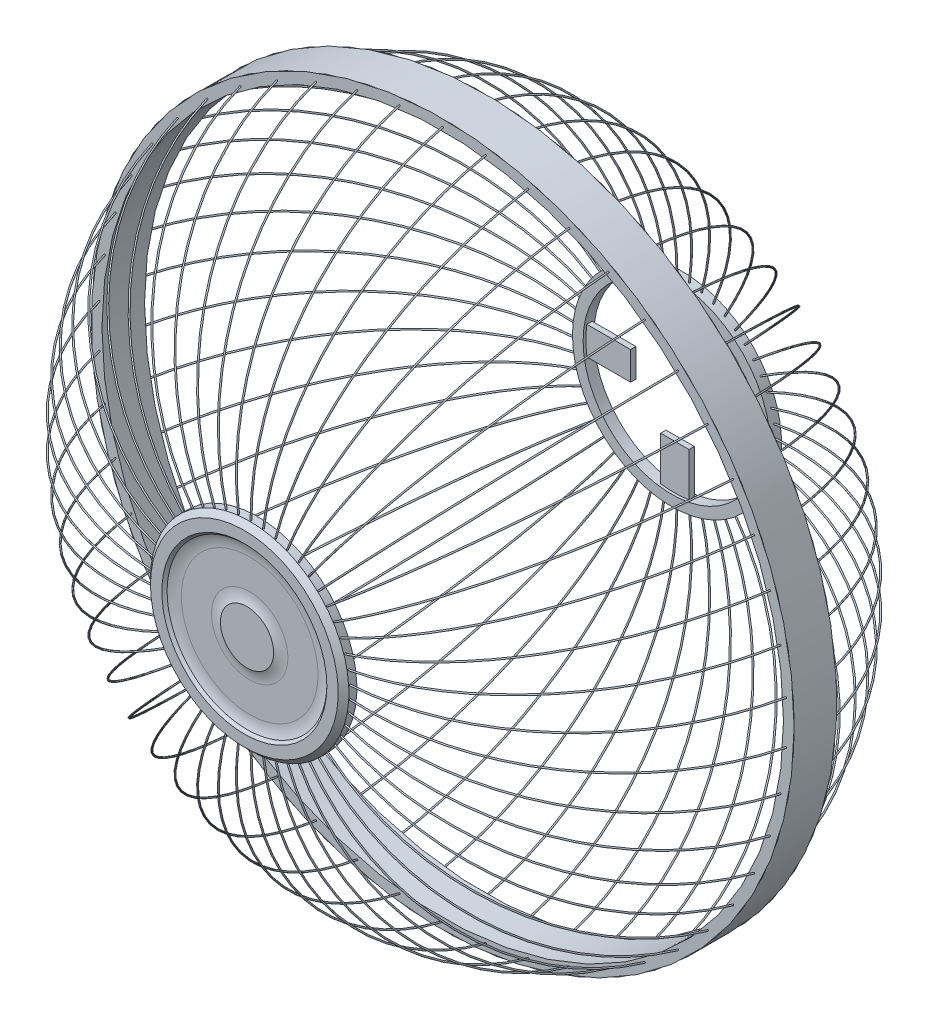
from build123d import *

# Parameters (mm, degrees)
SKETCH1_R                    = 167.64
SKETCH1_R_2                  = 162.56
EXTRUDE_THIN1_DEPTH          = 10.16
SKETCH2_R                    = 47.325577307
BOSS_EXTRUDE1_DEPTH          = 3.175
SKETCH10_R                   = 0.3175
SKETCH12_R                   = 47.325577307
SKETCH12_R_2                 = 42.245577307
EXTRUDE_THIN2_DEPTH          = 2.54
CHAMFER1_SIZE                = 2.54
SKETCH13_R                   = 38.1
CUT_EXTRUDE1_DEPTH           = 2.54
CHAMFER2_SIZE                = 1.27
SKETCH14_R                   = 12.7
BOSS_EXTRUDE3_DEPTH          = 1.27
FILLET1_R                    = 12.7
FILLET2_R                    = 12.7
CIRPATTERN1_COUNT            = 50
CIRPATTERN2_COUNT            = 2
CIRPATTERN2_COPY_1_SKETCH_R  = 0.3175
CIRPATTERN2_COPY_2_SKETCH_R  = 0.3175
CIRPATTERN2_COPY_3_SKETCH_R  = 0.3175
CIRPATTERN2_COPY_4_SKETCH_R  = 0.3175
CIRPATTERN2_COPY_5_SKETCH_R  = 0.3175
CIRPATTERN2_COPY_6_SKETCH_R  = 0.3175
CIRPATTERN2_COPY_7_SKETCH_R  = 0.3175
CIRPATTERN2_COPY_8_SKETCH_R  = 0.3175
CIRPATTERN2_COPY_9_SKETCH_R  = 0.3175
CIRPATTERN2_COPY_10_SKETCH_R = 0.3175
CIRPATTERN2_COPY_11_SKETCH_R = 0.3175
CIRPATTERN2_COPY_12_SKETCH_R = 0.3175
CIRPATTERN2_COPY_13_SKETCH_R = 0.3175
CIRPATTERN2_COPY_14_SKETCH_R = 0.3175
CIRPATTERN2_COPY_15_SKETCH_R = 0.3175
CIRPATTERN2_COPY_16_SKETCH_R = 0.3175
CIRPATTERN2_COPY_17_SKETCH_R = 0.3175
CIRPATTERN2_COPY_18_SKETCH_R = 0.3175
CIRPATTERN2_COPY_19_SKETCH_R = 0.3175
CIRPATTERN2_COPY_20_SKETCH_R = 0.3175
CIRPATTERN2_COPY_21_SKETCH_R = 0.3175
CIRPATTERN2_COPY_22_SKETCH_R = 0.3175
CIRPATTERN2_COPY_23_SKETCH_R = 0.3175
CIRPATTERN2_COPY_24_SKETCH_R = 0.3175
CIRPATTERN2_COPY_25_SKETCH_R = 0.3175
CIRPATTERN2_COPY_26_SKETCH_R = 0.3175
CIRPATTERN2_COPY_27_SKETCH_R = 0.3175
CIRPATTERN2_COPY_28_SKETCH_R = 0.3175
CIRPATTERN2_COPY_29_SKETCH_R = 0.3175
CIRPATTERN2_COPY_30_SKETCH_R = 0.3175
CIRPATTERN2_COPY_31_SKETCH_R = 0.3175
CIRPATTERN2_COPY_32_SKETCH_R = 0.3175
CIRPATTERN2_COPY_33_SKETCH_R = 0.3175
CIRPATTERN2_COPY_34_SKETCH_R = 0.3175
CIRPATTERN2_COPY_35_SKETCH_R = 0.3175
CIRPATTERN2_COPY_36_SKETCH_R = 0.3175
CIRPATTERN2_COPY_37_SKETCH_R = 0.3175
CIRPATTERN2_COPY_38_SKETCH_R = 0.3175
CIRPATTERN2_COPY_39_SKETCH_R = 0.3175
CIRPATTERN2_COPY_40_SKETCH_R = 0.3175
CIRPATTERN2_COPY_41_SKETCH_R = 0.3175
CIRPATTERN2_COPY_42_SKETCH_R = 0.3175
CIRPATTERN2_COPY_43_SKETCH_R = 0.3175
CIRPATTERN2_COPY_44_SKETCH_R = 0.3175
CIRPATTERN2_COPY_45_SKETCH_R = 0.3175
CIRPATTERN2_COPY_46_SKETCH_R = 0.3175
CIRPATTERN2_COPY_47_SKETCH_R = 0.3175
CIRPATTERN2_COPY_48_SKETCH_R = 0.3175
CIRPATTERN2_COPY_49_SKETCH_R = 0.3175
BOSS_EXTRUDE4_DEPTH          = 1.27
CIRPATTERN4_COUNT            = 4


with BuildPart() as part:
    # Sketch1 → Extrude-Thin1 (new, symmetric)
    with BuildSketch(Plane.XY):
        Circle(SKETCH1_R)
        Circle(SKETCH1_R_2, mode=Mode.SUBTRACT)
    extrude(amount=EXTRUDE_THIN1_DEPTH, both=True)

    # Sweep5: sweep along a path in Sketch4
    with BuildLine(Plane(origin=(0, 0, 0), x_dir=(0, 0, -1), z_dir=(1, 0, 0))) as sweep5_path:
        ThreePointArc((-10.16, 164.089600438), (-76.211159809, 121.629284641), (-101.6, 47.325577307))
    # Sketch10 → Sweep5 (sweep)
    with BuildSketch(Plane(origin=(0, 47.325577307, 101.6), x_dir=(1, 0, 0), z_dir=(0, 1, 0))):
        Circle(SKETCH10_R)
    sweep5 = sweep(path=sweep5_path.line)

    # CirPattern1: Sweep5 ×50 about axis
    cirpattern1_axis = Axis((0, 0, 10.16), (0, 0, 1))
    for i in range(1, CIRPATTERN1_COUNT):
        add(sweep5.rotate(cirpattern1_axis, i * 360 / CIRPATTERN1_COUNT))

    # CirPattern2: Sweep5 ×2 about axis
    cirpattern2_axis = Axis((0, 243.078, 0), (0, -1, 0))
    for i in range(1, CIRPATTERN2_COUNT):
        add(sweep5.rotate(cirpattern2_axis, i * 360 / CIRPATTERN2_COUNT))

    # CirPattern2 copy 1: sweep along a path in CirPattern2 copy 1 path
    with BuildLine(Plane(origin=(0, 0, 0), x_dir=(0, 0, 1), z_dir=(-0.9921147013144779, 0.12533323356430426, 0))) as cirpattern2_copy_1_path:
        ThreePointArc((-10.16, 164.089600438), (-76.211159809, 121.629284641), (-101.6, 47.325577307))
    # CirPattern2 copy 1 sketch → CirPattern2 copy 1 (sweep)
    with BuildSketch(Plane(origin=(5.931467634, 46.952400995, -101.6), x_dir=(-0.9921147013144779, 0.1253332335643043, 0), z_dir=(0.1253332335643043, 0.9921147013144779, 0))):
        Circle(CIRPATTERN2_COPY_1_SKETCH_R)
    sweep(path=cirpattern2_copy_1_path.line)

    # CirPattern2 copy 2: sweep along a path in CirPattern2 copy 2 path
    with BuildLine(Plane(origin=(0, 0, 0), x_dir=(0, 0, 1), z_dir=(-0.9685831611286311, 0.2486898871648548, 0))) as cirpattern2_copy_2_path:
        ThreePointArc((-10.16, 164.089600438), (-76.211159809, 121.629284641), (-101.6, 47.325577307))
    # CirPattern2 copy 2 sketch → CirPattern2 copy 2 (sweep)
    with BuildSketch(Plane(origin=(11.769392481, 45.83875727, -101.6), x_dir=(-0.9685831611286311, 0.24868988716485485, 0), z_dir=(0.24868988716485485, 0.9685831611286311, 0))):
        Circle(CIRPATTERN2_COPY_2_SKETCH_R)
    sweep(path=cirpattern2_copy_2_path.line)

    # CirPattern2 copy 3: sweep along a path in CirPattern2 copy 3 path
    with BuildLine(Plane(origin=(0, 0, 0), x_dir=(0, 0, 1), z_dir=(-0.9297764858882513, 0.368124552684678, 0))) as cirpattern2_copy_3_path:
        ThreePointArc((-10.16, 164.089600438), (-76.211159809, 121.629284641), (-101.6, 47.325577307))
    # CirPattern2 copy 3 sketch → CirPattern2 copy 3 (sweep)
    with BuildSketch(Plane(origin=(17.421706977, 44.002208961, -101.6), x_dir=(-0.9297764858882513, 0.36812455268467803, 0), z_dir=(0.36812455268467803, 0.9297764858882513, 0))):
        Circle(CIRPATTERN2_COPY_3_SKETCH_R)
    sweep(path=cirpattern2_copy_3_path.line)

    # CirPattern2 copy 4: sweep along a path in CirPattern2 copy 4 path
    with BuildLine(Plane(origin=(0, 0, 0), x_dir=(0, 0, 1), z_dir=(-0.8763066800438636, 0.4817536741017153, 0))) as cirpattern2_copy_4_path:
        ThreePointArc((-10.16, 164.089600438), (-76.211159809, 121.629284641), (-101.6, 47.325577307))
    # CirPattern2 copy 4 sketch → CirPattern2 copy 4 (sweep)
    with BuildSketch(Plane(origin=(22.799270747, 41.471719531, -101.6), x_dir=(-0.8763066800438636, 0.4817536741017154, 0), z_dir=(0.4817536741017154, 0.8763066800438636, 0))):
        Circle(CIRPATTERN2_COPY_4_SKETCH_R)
    sweep(path=cirpattern2_copy_4_path.line)

    # CirPattern2 copy 5: sweep along a path in CirPattern2 copy 5 path
    with BuildLine(Plane(origin=(0, 0, 0), x_dir=(0, 0, 1), z_dir=(-0.8090169943749475, 0.5877852522924731, 0))) as cirpattern2_copy_5_path:
        ThreePointArc((-10.16, 164.089600438), (-76.211159809, 121.629284641), (-101.6, 47.325577307))
    # CirPattern2 copy 5 sketch → CirPattern2 copy 5 (sweep)
    with BuildSketch(Plane(origin=(27.817276397, 38.28719631, -101.6), x_dir=(-0.8090169943749475, 0.5877852522924731, 0), z_dir=(0.5877852522924731, 0.8090169943749475, 0))):
        Circle(CIRPATTERN2_COPY_5_SKETCH_R)
    sweep(path=cirpattern2_copy_5_path.line)

    # CirPattern2 copy 6: sweep along a path in CirPattern2 copy 6 path
    with BuildLine(Plane(origin=(0, 0, 0), x_dir=(0, 0, 1), z_dir=(-0.7289686274214116, 0.6845471059286887, 0))) as cirpattern2_copy_6_path:
        ThreePointArc((-10.16, 164.089600438), (-76.211159809, 121.629284641), (-101.6, 47.325577307))
    # CirPattern2 copy 6 sketch → CirPattern2 copy 6 (sweep)
    with BuildSketch(Plane(origin=(32.396586982, 34.498861131, -101.6), x_dir=(-0.7289686274214116, 0.6845471059286887, 0), z_dir=(0.6845471059286887, 0.7289686274214116, 0))):
        Circle(CIRPATTERN2_COPY_6_SKETCH_R)
    sweep(path=cirpattern2_copy_6_path.line)

    # CirPattern2 copy 7: sweep along a path in CirPattern2 copy 7 path
    with BuildLine(Plane(origin=(0, 0, 0), x_dir=(0, 0, 1), z_dir=(-0.6374239897486897, 0.7705132427757893, 0))) as cirpattern2_copy_7_path:
        ThreePointArc((-10.16, 164.089600438), (-76.211159809, 121.629284641), (-101.6, 47.325577307))
    # CirPattern2 copy 7 sketch → CirPattern2 copy 7 (sweep)
    with BuildSketch(Plane(origin=(36.464984037, 30.166458304, -101.6), x_dir=(-0.6374239897486897, 0.7705132427757893, 0), z_dir=(0.7705132427757893, 0.6374239897486897, 0))):
        Circle(CIRPATTERN2_COPY_7_SKETCH_R)
    sweep(path=cirpattern2_copy_7_path.line)

    # CirPattern2 copy 8: sweep along a path in CirPattern2 copy 8 path
    with BuildLine(Plane(origin=(0, 0, 0), x_dir=(0, 0, 1), z_dir=(-0.5358267949789965, 0.8443279255020151, 0))) as cirpattern2_copy_8_path:
        ThreePointArc((-10.16, 164.089600438), (-76.211159809, 121.629284641), (-101.6, 47.325577307))
    # CirPattern2 copy 8 sketch → CirPattern2 copy 8 (sweep)
    with BuildSketch(Plane(origin=(39.958306511, 25.358312409, -101.6), x_dir=(-0.5358267949789965, 0.8443279255020151, 0), z_dir=(0.8443279255020151, 0.5358267949789965, 0))):
        Circle(CIRPATTERN2_COPY_8_SKETCH_R)
    sweep(path=cirpattern2_copy_8_path.line)

    # CirPattern2 copy 9: sweep along a path in CirPattern2 copy 9 path
    with BuildLine(Plane(origin=(0, 0, 0), x_dir=(0, 0, 1), z_dir=(-0.42577929156507266, 0.9048270524660196, 0))) as cirpattern2_copy_9_path:
        ThreePointArc((-10.16, 164.089600438), (-76.211159809, 121.629284641), (-101.6, 47.325577307))
    # CirPattern2 copy 9 sketch → CirPattern2 copy 9 (sweep)
    with BuildSketch(Plane(origin=(42.821462621, 20.150250779, -101.6), x_dir=(-0.4257792915650726, 0.9048270524660196, 0), z_dir=(0.9048270524660196, 0.4257792915650726, 0))):
        Circle(CIRPATTERN2_COPY_9_SKETCH_R)
    sweep(path=cirpattern2_copy_9_path.line)

    # CirPattern2 copy 10: sweep along a path in CirPattern2 copy 10 path
    with BuildLine(Plane(origin=(0, 0, 0), x_dir=(0, 0, 1), z_dir=(-0.30901699437494745, 0.9510565162951535, 0))) as cirpattern2_copy_10_path:
        ThreePointArc((-10.16, 164.089600438), (-76.211159809, 121.629284641), (-101.6, 47.325577307))
    # CirPattern2 copy 10 sketch → CirPattern2 copy 10 (sweep)
    with BuildSketch(Plane(origin=(45.009298685, 14.624407656, -101.6), x_dir=(-0.3090169943749474, 0.9510565162951535, 0), z_dir=(0.9510565162951535, 0.3090169943749474, 0))):
        Circle(CIRPATTERN2_COPY_10_SKETCH_R)
    sweep(path=cirpattern2_copy_10_path.line)

    # CirPattern2 copy 11: sweep along a path in CirPattern2 copy 11 path
    with BuildLine(Plane(origin=(0, 0, 0), x_dir=(0, 0, 1), z_dir=(-0.18738131458572452, 0.9822872507286887, 0))) as cirpattern2_copy_11_path:
        ThreePointArc((-10.16, 164.089600438), (-76.211159809, 121.629284641), (-101.6, 47.325577307))
    # CirPattern2 copy 11 sketch → CirPattern2 copy 11 (sweep)
    with BuildSketch(Plane(origin=(46.487311222, 8.867928889, -101.6), x_dir=(-0.18738131458572446, 0.9822872507286887, 0), z_dir=(0.9822872507286887, 0.18738131458572446, 0))):
        Circle(CIRPATTERN2_COPY_11_SKETCH_R)
    sweep(path=cirpattern2_copy_11_path.line)

    # CirPattern2 copy 12: sweep along a path in CirPattern2 copy 12 path
    with BuildLine(Plane(origin=(0, 0, 0), x_dir=(0, 0, 1), z_dir=(-0.0627905195293133, 0.9980267284282716, 0))) as cirpattern2_copy_12_path:
        ThreePointArc((-10.16, 164.089600438), (-76.211159809, 121.629284641), (-101.6, 47.325577307))
    # CirPattern2 copy 12 sketch → CirPattern2 copy 12 (sweep)
    with BuildSketch(Plane(origin=(47.232191091, 2.971597586, -101.6), x_dir=(-0.06279051952931325, 0.9980267284282716, 0), z_dir=(0.9980267284282716, 0.06279051952931325, 0))):
        Circle(CIRPATTERN2_COPY_12_SKETCH_R)
    sweep(path=cirpattern2_copy_12_path.line)

    # CirPattern2 copy 13: sweep along a path in CirPattern2 copy 13 path
    with BuildLine(Plane(origin=(0, 0, 0), x_dir=(0, 0, 1), z_dir=(0.0627905195293134, 0.9980267284282716, 0))) as cirpattern2_copy_13_path:
        ThreePointArc((-10.16, 164.089600438), (-76.211159809, 121.629284641), (-101.6, 47.325577307))
    # CirPattern2 copy 13 sketch → CirPattern2 copy 13 (sweep)
    with BuildSketch(Plane(origin=(47.232191091, -2.971597586, -101.6), x_dir=(0.06279051952931346, 0.9980267284282716, 0), z_dir=(0.9980267284282716, -0.06279051952931346, 0))):
        Circle(CIRPATTERN2_COPY_13_SKETCH_R)
    sweep(path=cirpattern2_copy_13_path.line)

    # CirPattern2 copy 14: sweep along a path in CirPattern2 copy 14 path
    with BuildLine(Plane(origin=(0, 0, 0), x_dir=(0, 0, 1), z_dir=(0.1873813145857246, 0.9822872507286887, 0))) as cirpattern2_copy_14_path:
        ThreePointArc((-10.16, 164.089600438), (-76.211159809, 121.629284641), (-101.6, 47.325577307))
    # CirPattern2 copy 14 sketch → CirPattern2 copy 14 (sweep)
    with BuildSketch(Plane(origin=(46.487311222, -8.867928889, -101.6), x_dir=(0.18738131458572466, 0.9822872507286887, 0), z_dir=(0.9822872507286887, -0.18738131458572466, 0))):
        Circle(CIRPATTERN2_COPY_14_SKETCH_R)
    sweep(path=cirpattern2_copy_14_path.line)

    # CirPattern2 copy 15: sweep along a path in CirPattern2 copy 15 path
    with BuildLine(Plane(origin=(0, 0, 0), x_dir=(0, 0, 1), z_dir=(0.30901699437494734, 0.9510565162951536, 0))) as cirpattern2_copy_15_path:
        ThreePointArc((-10.16, 164.089600438), (-76.211159809, 121.629284641), (-101.6, 47.325577307))
    # CirPattern2 copy 15 sketch → CirPattern2 copy 15 (sweep)
    with BuildSketch(Plane(origin=(45.009298685, -14.624407656, -101.6), x_dir=(0.3090169943749474, 0.9510565162951536, 0), z_dir=(0.9510565162951536, -0.3090169943749474, 0))):
        Circle(CIRPATTERN2_COPY_15_SKETCH_R)
    sweep(path=cirpattern2_copy_15_path.line)

    # CirPattern2 copy 16: sweep along a path in CirPattern2 copy 16 path
    with BuildLine(Plane(origin=(0, 0, 0), x_dir=(0, 0, 1), z_dir=(0.4257792915650727, 0.9048270524660195, 0))) as cirpattern2_copy_16_path:
        ThreePointArc((-10.16, 164.089600438), (-76.211159809, 121.629284641), (-101.6, 47.325577307))
    # CirPattern2 copy 16 sketch → CirPattern2 copy 16 (sweep)
    with BuildSketch(Plane(origin=(42.821462621, -20.150250779, -101.6), x_dir=(0.42577929156507277, 0.9048270524660195, 0), z_dir=(0.9048270524660195, -0.42577929156507277, 0))):
        Circle(CIRPATTERN2_COPY_16_SKETCH_R)
    sweep(path=cirpattern2_copy_16_path.line)

    # CirPattern2 copy 17: sweep along a path in CirPattern2 copy 17 path
    with BuildLine(Plane(origin=(0, 0, 0), x_dir=(0, 0, 1), z_dir=(0.5358267949789969, 0.844327925502015, 0))) as cirpattern2_copy_17_path:
        ThreePointArc((-10.16, 164.089600438), (-76.211159809, 121.629284641), (-101.6, 47.325577307))
    # CirPattern2 copy 17 sketch → CirPattern2 copy 17 (sweep)
    with BuildSketch(Plane(origin=(39.958306511, -25.358312409, -101.6), x_dir=(0.5358267949789969, 0.844327925502015, 0), z_dir=(0.844327925502015, -0.5358267949789969, 0))):
        Circle(CIRPATTERN2_COPY_17_SKETCH_R)
    sweep(path=cirpattern2_copy_17_path.line)

    # CirPattern2 copy 18: sweep along a path in CirPattern2 copy 18 path
    with BuildLine(Plane(origin=(0, 0, 0), x_dir=(0, 0, 1), z_dir=(0.6374239897486897, 0.7705132427757893, 0))) as cirpattern2_copy_18_path:
        ThreePointArc((-10.16, 164.089600438), (-76.211159809, 121.629284641), (-101.6, 47.325577307))
    # CirPattern2 copy 18 sketch → CirPattern2 copy 18 (sweep)
    with BuildSketch(Plane(origin=(36.464984037, -30.166458304, -101.6), x_dir=(0.6374239897486897, 0.7705132427757893, 0), z_dir=(0.7705132427757893, -0.6374239897486897, 0))):
        Circle(CIRPATTERN2_COPY_18_SKETCH_R)
    sweep(path=cirpattern2_copy_18_path.line)

    # CirPattern2 copy 19: sweep along a path in CirPattern2 copy 19 path
    with BuildLine(Plane(origin=(0, 0, 0), x_dir=(0, 0, 1), z_dir=(0.7289686274214117, 0.6845471059286885, 0))) as cirpattern2_copy_19_path:
        ThreePointArc((-10.16, 164.089600438), (-76.211159809, 121.629284641), (-101.6, 47.325577307))
    # CirPattern2 copy 19 sketch → CirPattern2 copy 19 (sweep)
    with BuildSketch(Plane(origin=(32.396586982, -34.498861131, -101.6), x_dir=(0.7289686274214117, 0.6845471059286885, 0), z_dir=(0.6845471059286885, -0.7289686274214117, 0))):
        Circle(CIRPATTERN2_COPY_19_SKETCH_R)
    sweep(path=cirpattern2_copy_19_path.line)

    # CirPattern2 copy 20: sweep along a path in CirPattern2 copy 20 path
    with BuildLine(Plane(origin=(0, 0, 0), x_dir=(0, 0, 1), z_dir=(0.8090169943749473, 0.5877852522924732, 0))) as cirpattern2_copy_20_path:
        ThreePointArc((-10.16, 164.089600438), (-76.211159809, 121.629284641), (-101.6, 47.325577307))
    # CirPattern2 copy 20 sketch → CirPattern2 copy 20 (sweep)
    with BuildSketch(Plane(origin=(27.817276397, -38.28719631, -101.6), x_dir=(0.8090169943749473, 0.5877852522924732, 0), z_dir=(0.5877852522924732, -0.8090169943749473, 0))):
        Circle(CIRPATTERN2_COPY_20_SKETCH_R)
    sweep(path=cirpattern2_copy_20_path.line)

    # CirPattern2 copy 21: sweep along a path in CirPattern2 copy 21 path
    with BuildLine(Plane(origin=(0, 0, 0), x_dir=(0, 0, 1), z_dir=(0.8763066800438636, 0.4817536741017152, 0))) as cirpattern2_copy_21_path:
        ThreePointArc((-10.16, 164.089600438), (-76.211159809, 121.629284641), (-101.6, 47.325577307))
    # CirPattern2 copy 21 sketch → CirPattern2 copy 21 (sweep)
    with BuildSketch(Plane(origin=(22.799270747, -41.471719531, -101.6), x_dir=(0.8763066800438636, 0.48175367410171516, 0), z_dir=(0.48175367410171516, -0.8763066800438636, 0))):
        Circle(CIRPATTERN2_COPY_21_SKETCH_R)
    sweep(path=cirpattern2_copy_21_path.line)

    # CirPattern2 copy 22: sweep along a path in CirPattern2 copy 22 path
    with BuildLine(Plane(origin=(0, 0, 0), x_dir=(0, 0, 1), z_dir=(0.9297764858882515, 0.36812455268467775, 0))) as cirpattern2_copy_22_path:
        ThreePointArc((-10.16, 164.089600438), (-76.211159809, 121.629284641), (-101.6, 47.325577307))
    # CirPattern2 copy 22 sketch → CirPattern2 copy 22 (sweep)
    with BuildSketch(Plane(origin=(17.421706977, -44.002208961, -101.6), x_dir=(0.9297764858882515, 0.3681245526846777, 0), z_dir=(0.3681245526846777, -0.9297764858882515, 0))):
        Circle(CIRPATTERN2_COPY_22_SKETCH_R)
    sweep(path=cirpattern2_copy_22_path.line)

    # CirPattern2 copy 23: sweep along a path in CirPattern2 copy 23 path
    with BuildLine(Plane(origin=(0, 0, 0), x_dir=(0, 0, 1), z_dir=(0.9685831611286311, 0.24868988716485482, 0))) as cirpattern2_copy_23_path:
        ThreePointArc((-10.16, 164.089600438), (-76.211159809, 121.629284641), (-101.6, 47.325577307))
    # CirPattern2 copy 23 sketch → CirPattern2 copy 23 (sweep)
    with BuildSketch(Plane(origin=(11.769392481, -45.83875727, -101.6), x_dir=(0.9685831611286311, 0.24868988716485477, 0), z_dir=(0.24868988716485477, -0.9685831611286311, 0))):
        Circle(CIRPATTERN2_COPY_23_SKETCH_R)
    sweep(path=cirpattern2_copy_23_path.line)

    # CirPattern2 copy 24: sweep along a path in CirPattern2 copy 24 path
    with BuildLine(Plane(origin=(0, 0, 0), x_dir=(0, 0, 1), z_dir=(0.9921147013144779, 0.1253332335643041, 0))) as cirpattern2_copy_24_path:
        ThreePointArc((-10.16, 164.089600438), (-76.211159809, 121.629284641), (-101.6, 47.325577307))
    # CirPattern2 copy 24 sketch → CirPattern2 copy 24 (sweep)
    with BuildSketch(Plane(origin=(5.931467634, -46.952400995, -101.6), x_dir=(0.9921147013144779, 0.12533323356430404, 0), z_dir=(0.12533323356430404, -0.9921147013144779, 0))):
        Circle(CIRPATTERN2_COPY_24_SKETCH_R)
    sweep(path=cirpattern2_copy_24_path.line)

    # CirPattern2 copy 25: sweep along a path in CirPattern2 copy 25 path
    with BuildLine(Plane(origin=(0, 0, 0), x_dir=(0, 0, 1), z_dir=(1, 0, 0))) as cirpattern2_copy_25_path:
        ThreePointArc((-10.16, 164.089600438), (-76.211159809, 121.629284641), (-101.6, 47.325577307))
    # CirPattern2 copy 25 sketch → CirPattern2 copy 25 (sweep)
    with BuildSketch(Plane(origin=(0, -47.325577307, -101.6), x_dir=(1, 0, 0), z_dir=(0, -1, 0))):
        Circle(CIRPATTERN2_COPY_25_SKETCH_R)
    sweep(path=cirpattern2_copy_25_path.line)

    # CirPattern2 copy 26: sweep along a path in CirPattern2 copy 26 path
    with BuildLine(Plane(origin=(0, 0, 0), x_dir=(0, 0, 1), z_dir=(0.9921147013144779, -0.12533323356430429, 0))) as cirpattern2_copy_26_path:
        ThreePointArc((-10.16, 164.089600438), (-76.211159809, 121.629284641), (-101.6, 47.325577307))
    # CirPattern2 copy 26 sketch → CirPattern2 copy 26 (sweep)
    with BuildSketch(Plane(origin=(-5.931467634, -46.952400995, -101.6), x_dir=(0.9921147013144779, -0.12533323356430434, 0), z_dir=(-0.12533323356430434, -0.9921147013144779, 0))):
        Circle(CIRPATTERN2_COPY_26_SKETCH_R)
    sweep(path=cirpattern2_copy_26_path.line)

    # CirPattern2 copy 27: sweep along a path in CirPattern2 copy 27 path
    with BuildLine(Plane(origin=(0, 0, 0), x_dir=(0, 0, 1), z_dir=(0.9685831611286311, -0.24868988716485502, 0))) as cirpattern2_copy_27_path:
        ThreePointArc((-10.16, 164.089600438), (-76.211159809, 121.629284641), (-101.6, 47.325577307))
    # CirPattern2 copy 27 sketch → CirPattern2 copy 27 (sweep)
    with BuildSketch(Plane(origin=(-11.769392481, -45.83875727, -101.6), x_dir=(0.9685831611286311, -0.24868988716485507, 0), z_dir=(-0.24868988716485507, -0.9685831611286311, 0))):
        Circle(CIRPATTERN2_COPY_27_SKETCH_R)
    sweep(path=cirpattern2_copy_27_path.line)

    # CirPattern2 copy 28: sweep along a path in CirPattern2 copy 28 path
    with BuildLine(Plane(origin=(0, 0, 0), x_dir=(0, 0, 1), z_dir=(0.9297764858882515, -0.3681245526846779, 0))) as cirpattern2_copy_28_path:
        ThreePointArc((-10.16, 164.089600438), (-76.211159809, 121.629284641), (-101.6, 47.325577307))
    # CirPattern2 copy 28 sketch → CirPattern2 copy 28 (sweep)
    with BuildSketch(Plane(origin=(-17.421706977, -44.002208961, -101.6), x_dir=(0.9297764858882515, -0.368124552684678, 0), z_dir=(-0.368124552684678, -0.9297764858882515, 0))):
        Circle(CIRPATTERN2_COPY_28_SKETCH_R)
    sweep(path=cirpattern2_copy_28_path.line)

    # CirPattern2 copy 29: sweep along a path in CirPattern2 copy 29 path
    with BuildLine(Plane(origin=(0, 0, 0), x_dir=(0, 0, 1), z_dir=(0.8763066800438635, -0.4817536741017154, 0))) as cirpattern2_copy_29_path:
        ThreePointArc((-10.16, 164.089600438), (-76.211159809, 121.629284641), (-101.6, 47.325577307))
    # CirPattern2 copy 29 sketch → CirPattern2 copy 29 (sweep)
    with BuildSketch(Plane(origin=(-22.799270747, -41.471719531, -101.6), x_dir=(0.8763066800438635, -0.48175367410171543, 0), z_dir=(-0.48175367410171543, -0.8763066800438635, 0))):
        Circle(CIRPATTERN2_COPY_29_SKETCH_R)
    sweep(path=cirpattern2_copy_29_path.line)

    # CirPattern2 copy 30: sweep along a path in CirPattern2 copy 30 path
    with BuildLine(Plane(origin=(0, 0, 0), x_dir=(0, 0, 1), z_dir=(0.8090169943749476, -0.587785252292473, 0))) as cirpattern2_copy_30_path:
        ThreePointArc((-10.16, 164.089600438), (-76.211159809, 121.629284641), (-101.6, 47.325577307))
    # CirPattern2 copy 30 sketch → CirPattern2 copy 30 (sweep)
    with BuildSketch(Plane(origin=(-27.817276397, -38.28719631, -101.6), x_dir=(0.8090169943749476, -0.587785252292473, 0), z_dir=(-0.587785252292473, -0.8090169943749476, 0))):
        Circle(CIRPATTERN2_COPY_30_SKETCH_R)
    sweep(path=cirpattern2_copy_30_path.line)

    # CirPattern2 copy 31: sweep along a path in CirPattern2 copy 31 path
    with BuildLine(Plane(origin=(0, 0, 0), x_dir=(0, 0, 1), z_dir=(0.7289686274214116, -0.6845471059286887, 0))) as cirpattern2_copy_31_path:
        ThreePointArc((-10.16, 164.089600438), (-76.211159809, 121.629284641), (-101.6, 47.325577307))
    # CirPattern2 copy 31 sketch → CirPattern2 copy 31 (sweep)
    with BuildSketch(Plane(origin=(-32.396586982, -34.498861131, -101.6), x_dir=(0.7289686274214116, -0.6845471059286887, 0), z_dir=(-0.6845471059286887, -0.7289686274214116, 0))):
        Circle(CIRPATTERN2_COPY_31_SKETCH_R)
    sweep(path=cirpattern2_copy_31_path.line)

    # CirPattern2 copy 32: sweep along a path in CirPattern2 copy 32 path
    with BuildLine(Plane(origin=(0, 0, 0), x_dir=(0, 0, 1), z_dir=(0.6374239897486895, -0.7705132427757894, 0))) as cirpattern2_copy_32_path:
        ThreePointArc((-10.16, 164.089600438), (-76.211159809, 121.629284641), (-101.6, 47.325577307))
    # CirPattern2 copy 32 sketch → CirPattern2 copy 32 (sweep)
    with BuildSketch(Plane(origin=(-36.464984037, -30.166458304, -101.6), x_dir=(0.6374239897486895, -0.7705132427757894, 0), z_dir=(-0.7705132427757894, -0.6374239897486895, 0))):
        Circle(CIRPATTERN2_COPY_32_SKETCH_R)
    sweep(path=cirpattern2_copy_32_path.line)

    # CirPattern2 copy 33: sweep along a path in CirPattern2 copy 33 path
    with BuildLine(Plane(origin=(0, 0, 0), x_dir=(0, 0, 1), z_dir=(0.5358267949789971, -0.8443279255020149, 0))) as cirpattern2_copy_33_path:
        ThreePointArc((-10.16, 164.089600438), (-76.211159809, 121.629284641), (-101.6, 47.325577307))
    # CirPattern2 copy 33 sketch → CirPattern2 copy 33 (sweep)
    with BuildSketch(Plane(origin=(-39.958306511, -25.358312409, -101.6), x_dir=(0.5358267949789971, -0.8443279255020149, 0), z_dir=(-0.8443279255020149, -0.5358267949789971, 0))):
        Circle(CIRPATTERN2_COPY_33_SKETCH_R)
    sweep(path=cirpattern2_copy_33_path.line)

    # CirPattern2 copy 34: sweep along a path in CirPattern2 copy 34 path
    with BuildLine(Plane(origin=(0, 0, 0), x_dir=(0, 0, 1), z_dir=(0.42577929156507216, -0.9048270524660198, 0))) as cirpattern2_copy_34_path:
        ThreePointArc((-10.16, 164.089600438), (-76.211159809, 121.629284641), (-101.6, 47.325577307))
    # CirPattern2 copy 34 sketch → CirPattern2 copy 34 (sweep)
    with BuildSketch(Plane(origin=(-42.821462621, -20.150250779, -101.6), x_dir=(0.4257792915650721, -0.9048270524660198, 0), z_dir=(-0.9048270524660198, -0.4257792915650721, 0))):
        Circle(CIRPATTERN2_COPY_34_SKETCH_R)
    sweep(path=cirpattern2_copy_34_path.line)

    # CirPattern2 copy 35: sweep along a path in CirPattern2 copy 35 path
    with BuildLine(Plane(origin=(0, 0, 0), x_dir=(0, 0, 1), z_dir=(0.30901699437494756, -0.9510565162951535, 0))) as cirpattern2_copy_35_path:
        ThreePointArc((-10.16, 164.089600438), (-76.211159809, 121.629284641), (-101.6, 47.325577307))
    # CirPattern2 copy 35 sketch → CirPattern2 copy 35 (sweep)
    with BuildSketch(Plane(origin=(-45.009298685, -14.624407656, -101.6), x_dir=(0.3090169943749475, -0.9510565162951535, 0), z_dir=(-0.9510565162951535, -0.3090169943749475, 0))):
        Circle(CIRPATTERN2_COPY_35_SKETCH_R)
    sweep(path=cirpattern2_copy_35_path.line)

    # CirPattern2 copy 36: sweep along a path in CirPattern2 copy 36 path
    with BuildLine(Plane(origin=(0, 0, 0), x_dir=(0, 0, 1), z_dir=(0.18738131458572463, -0.9822872507286887, 0))) as cirpattern2_copy_36_path:
        ThreePointArc((-10.16, 164.089600438), (-76.211159809, 121.629284641), (-101.6, 47.325577307))
    # CirPattern2 copy 36 sketch → CirPattern2 copy 36 (sweep)
    with BuildSketch(Plane(origin=(-46.487311222, -8.867928889, -101.6), x_dir=(0.18738131458572457, -0.9822872507286887, 0), z_dir=(-0.9822872507286887, -0.18738131458572457, 0))):
        Circle(CIRPATTERN2_COPY_36_SKETCH_R)
    sweep(path=cirpattern2_copy_36_path.line)

    # CirPattern2 copy 37: sweep along a path in CirPattern2 copy 37 path
    with BuildLine(Plane(origin=(0, 0, 0), x_dir=(0, 0, 1), z_dir=(0.06279051952931321, -0.9980267284282716, 0))) as cirpattern2_copy_37_path:
        ThreePointArc((-10.16, 164.089600438), (-76.211159809, 121.629284641), (-101.6, 47.325577307))
    # CirPattern2 copy 37 sketch → CirPattern2 copy 37 (sweep)
    with BuildSketch(Plane(origin=(-47.232191091, -2.971597586, -101.6), x_dir=(0.06279051952931315, -0.9980267284282716, 0), z_dir=(-0.9980267284282716, -0.06279051952931315, 0))):
        Circle(CIRPATTERN2_COPY_37_SKETCH_R)
    sweep(path=cirpattern2_copy_37_path.line)

    # CirPattern2 copy 38: sweep along a path in CirPattern2 copy 38 path
    with BuildLine(Plane(origin=(0, 0, 0), x_dir=(0, 0, 1), z_dir=(-0.06279051952931372, -0.9980267284282716, 0))) as cirpattern2_copy_38_path:
        ThreePointArc((-10.16, 164.089600438), (-76.211159809, 121.629284641), (-101.6, 47.325577307))
    # CirPattern2 copy 38 sketch → CirPattern2 copy 38 (sweep)
    with BuildSketch(Plane(origin=(-47.232191091, 2.971597586, -101.6), x_dir=(-0.06279051952931378, -0.9980267284282716, 0), z_dir=(-0.9980267284282716, 0.06279051952931378, 0))):
        Circle(CIRPATTERN2_COPY_38_SKETCH_R)
    sweep(path=cirpattern2_copy_38_path.line)

    # CirPattern2 copy 39: sweep along a path in CirPattern2 copy 39 path
    with BuildLine(Plane(origin=(0, 0, 0), x_dir=(0, 0, 1), z_dir=(-0.18738131458572513, -0.9822872507286886, 0))) as cirpattern2_copy_39_path:
        ThreePointArc((-10.16, 164.089600438), (-76.211159809, 121.629284641), (-101.6, 47.325577307))
    # CirPattern2 copy 39 sketch → CirPattern2 copy 39 (sweep)
    with BuildSketch(Plane(origin=(-46.487311222, 8.867928889, -101.6), x_dir=(-0.18738131458572518, -0.9822872507286886, 0), z_dir=(-0.9822872507286886, 0.18738131458572518, 0))):
        Circle(CIRPATTERN2_COPY_39_SKETCH_R)
    sweep(path=cirpattern2_copy_39_path.line)

    # CirPattern2 copy 40: sweep along a path in CirPattern2 copy 40 path
    with BuildLine(Plane(origin=(0, 0, 0), x_dir=(0, 0, 1), z_dir=(-0.30901699437494723, -0.9510565162951536, 0))) as cirpattern2_copy_40_path:
        ThreePointArc((-10.16, 164.089600438), (-76.211159809, 121.629284641), (-101.6, 47.325577307))
    # CirPattern2 copy 40 sketch → CirPattern2 copy 40 (sweep)
    with BuildSketch(Plane(origin=(-45.009298685, 14.624407656, -101.6), x_dir=(-0.3090169943749473, -0.9510565162951536, 0), z_dir=(-0.9510565162951536, 0.3090169943749473, 0))):
        Circle(CIRPATTERN2_COPY_40_SKETCH_R)
    sweep(path=cirpattern2_copy_40_path.line)

    # CirPattern2 copy 41: sweep along a path in CirPattern2 copy 41 path
    with BuildLine(Plane(origin=(0, 0, 0), x_dir=(0, 0, 1), z_dir=(-0.4257792915650726, -0.9048270524660196, 0))) as cirpattern2_copy_41_path:
        ThreePointArc((-10.16, 164.089600438), (-76.211159809, 121.629284641), (-101.6, 47.325577307))
    # CirPattern2 copy 41 sketch → CirPattern2 copy 41 (sweep)
    with BuildSketch(Plane(origin=(-42.821462621, 20.150250779, -101.6), x_dir=(-0.42577929156507266, -0.9048270524660196, 0), z_dir=(-0.9048270524660196, 0.42577929156507266, 0))):
        Circle(CIRPATTERN2_COPY_41_SKETCH_R)
    sweep(path=cirpattern2_copy_41_path.line)

    # CirPattern2 copy 42: sweep along a path in CirPattern2 copy 42 path
    with BuildLine(Plane(origin=(0, 0, 0), x_dir=(0, 0, 1), z_dir=(-0.5358267949789968, -0.844327925502015, 0))) as cirpattern2_copy_42_path:
        ThreePointArc((-10.16, 164.089600438), (-76.211159809, 121.629284641), (-101.6, 47.325577307))
    # CirPattern2 copy 42 sketch → CirPattern2 copy 42 (sweep)
    with BuildSketch(Plane(origin=(-39.958306511, 25.358312409, -101.6), x_dir=(-0.5358267949789968, -0.844327925502015, 0), z_dir=(-0.844327925502015, 0.5358267949789968, 0))):
        Circle(CIRPATTERN2_COPY_42_SKETCH_R)
    sweep(path=cirpattern2_copy_42_path.line)

    # CirPattern2 copy 43: sweep along a path in CirPattern2 copy 43 path
    with BuildLine(Plane(origin=(0, 0, 0), x_dir=(0, 0, 1), z_dir=(-0.63742398974869, -0.770513242775789, 0))) as cirpattern2_copy_43_path:
        ThreePointArc((-10.16, 164.089600438), (-76.211159809, 121.629284641), (-101.6, 47.325577307))
    # CirPattern2 copy 43 sketch → CirPattern2 copy 43 (sweep)
    with BuildSketch(Plane(origin=(-36.464984037, 30.166458304, -101.6), x_dir=(-0.63742398974869, -0.770513242775789, 0), z_dir=(-0.770513242775789, 0.63742398974869, 0))):
        Circle(CIRPATTERN2_COPY_43_SKETCH_R)
    sweep(path=cirpattern2_copy_43_path.line)

    # CirPattern2 copy 44: sweep along a path in CirPattern2 copy 44 path
    with BuildLine(Plane(origin=(0, 0, 0), x_dir=(0, 0, 1), z_dir=(-0.7289686274214119, -0.6845471059286883, 0))) as cirpattern2_copy_44_path:
        ThreePointArc((-10.16, 164.089600438), (-76.211159809, 121.629284641), (-101.6, 47.325577307))
    # CirPattern2 copy 44 sketch → CirPattern2 copy 44 (sweep)
    with BuildSketch(Plane(origin=(-32.396586982, 34.498861131, -101.6), x_dir=(-0.7289686274214119, -0.6845471059286883, 0), z_dir=(-0.6845471059286883, 0.7289686274214119, 0))):
        Circle(CIRPATTERN2_COPY_44_SKETCH_R)
    sweep(path=cirpattern2_copy_44_path.line)

    # CirPattern2 copy 45: sweep along a path in CirPattern2 copy 45 path
    with BuildLine(Plane(origin=(0, 0, 0), x_dir=(0, 0, 1), z_dir=(-0.8090169943749473, -0.5877852522924734, 0))) as cirpattern2_copy_45_path:
        ThreePointArc((-10.16, 164.089600438), (-76.211159809, 121.629284641), (-101.6, 47.325577307))
    # CirPattern2 copy 45 sketch → CirPattern2 copy 45 (sweep)
    with BuildSketch(Plane(origin=(-27.817276397, 38.28719631, -101.6), x_dir=(-0.8090169943749473, -0.5877852522924734, 0), z_dir=(-0.5877852522924734, 0.8090169943749473, 0))):
        Circle(CIRPATTERN2_COPY_45_SKETCH_R)
    sweep(path=cirpattern2_copy_45_path.line)

    # CirPattern2 copy 46: sweep along a path in CirPattern2 copy 46 path
    with BuildLine(Plane(origin=(0, 0, 0), x_dir=(0, 0, 1), z_dir=(-0.8763066800438636, -0.4817536741017153, 0))) as cirpattern2_copy_46_path:
        ThreePointArc((-10.16, 164.089600438), (-76.211159809, 121.629284641), (-101.6, 47.325577307))
    # CirPattern2 copy 46 sketch → CirPattern2 copy 46 (sweep)
    with BuildSketch(Plane(origin=(-22.799270747, 41.471719531, -101.6), x_dir=(-0.8763066800438636, -0.48175367410171527, 0), z_dir=(-0.48175367410171527, 0.8763066800438636, 0))):
        Circle(CIRPATTERN2_COPY_46_SKETCH_R)
    sweep(path=cirpattern2_copy_46_path.line)

    # CirPattern2 copy 47: sweep along a path in CirPattern2 copy 47 path
    with BuildLine(Plane(origin=(0, 0, 0), x_dir=(0, 0, 1), z_dir=(-0.9297764858882515, -0.36812455268467786, 0))) as cirpattern2_copy_47_path:
        ThreePointArc((-10.16, 164.089600438), (-76.211159809, 121.629284641), (-101.6, 47.325577307))
    # CirPattern2 copy 47 sketch → CirPattern2 copy 47 (sweep)
    with BuildSketch(Plane(origin=(-17.421706977, 44.002208961, -101.6), x_dir=(-0.9297764858882515, -0.3681245526846778, 0), z_dir=(-0.3681245526846778, 0.9297764858882515, 0))):
        Circle(CIRPATTERN2_COPY_47_SKETCH_R)
    sweep(path=cirpattern2_copy_47_path.line)

    # CirPattern2 copy 48: sweep along a path in CirPattern2 copy 48 path
    with BuildLine(Plane(origin=(0, 0, 0), x_dir=(0, 0, 1), z_dir=(-0.9685831611286312, -0.2486898871648545, 0))) as cirpattern2_copy_48_path:
        ThreePointArc((-10.16, 164.089600438), (-76.211159809, 121.629284641), (-101.6, 47.325577307))
    # CirPattern2 copy 48 sketch → CirPattern2 copy 48 (sweep)
    with BuildSketch(Plane(origin=(-11.769392481, 45.83875727, -101.6), x_dir=(-0.9685831611286312, -0.24868988716485443, 0), z_dir=(-0.24868988716485443, 0.9685831611286312, 0))):
        Circle(CIRPATTERN2_COPY_48_SKETCH_R)
    sweep(path=cirpattern2_copy_48_path.line)

    # CirPattern2 copy 49: sweep along a path in CirPattern2 copy 49 path
    with BuildLine(Plane(origin=(0, 0, 0), x_dir=(0, 0, 1), z_dir=(-0.9921147013144779, -0.1253332335643038, 0))) as cirpattern2_copy_49_path:
        ThreePointArc((-10.16, 164.089600438), (-76.211159809, 121.629284641), (-101.6, 47.325577307))
    # CirPattern2 copy 49 sketch → CirPattern2 copy 49 (sweep)
    with BuildSketch(Plane(origin=(-5.931467634, 46.952400995, -101.6), x_dir=(-0.9921147013144779, -0.12533323356430373, 0), z_dir=(-0.12533323356430373, 0.9921147013144779, 0))):
        Circle(CIRPATTERN2_COPY_49_SKETCH_R)
    sweep(path=cirpattern2_copy_49_path.line)


with BuildPart() as body_2:
    # Sketch2 → Boss-Extrude1 (new, symmetric)
    with BuildSketch(Plane.XY.offset(101.6)):
        Circle(SKETCH2_R)
    extrude(amount=BOSS_EXTRUDE1_DEPTH, both=True)

    # Chamfer1
    chamfer1_edges = [body_2.edges().sort_by_distance(p)[0] for p in [
        (-47.325577307, 0, 104.775),
    ]]
    chamfer(chamfer1_edges, length=CHAMFER1_SIZE)

    # Sketch13 → Cut-Extrude1 (cut)
    with BuildSketch(Plane.XY.offset(104.775)):
        Circle(SKETCH13_R)
    extrude(amount=-CUT_EXTRUDE1_DEPTH, mode=Mode.SUBTRACT)

    # Chamfer2
    chamfer2_edges = [body_2.edges().sort_by_distance(p)[0] for p in [
        (-38.1, 0, 104.775),
    ]]
    chamfer(chamfer2_edges, length=CHAMFER2_SIZE)

    # Sketch14 → Boss-Extrude3 (add)
    with BuildSketch(Plane.XY.offset(102.235)):
        Circle(SKETCH14_R)
    extrude(amount=BOSS_EXTRUDE3_DEPTH)

    # Fillet1
    # the kernel refuses this fillet: 12.7 mm, written as the material it adds along each edge
    with BuildSketch(Plane(origin=(0, 0, 102.235), x_dir=(1, 0, 0), z_dir=(0, -1, 0))) as fillet1_piece_1:
        with BuildLine():
            CenterArc((18.235801658, 12.7), FILLET1_R, 244.158067237, 25.841932763)
            Line((12.7, 1.27), (12.589283967, 1.0414))
            ThreePointArc((12.589283967, 1.0414), (12.446, 0.635), (12.446, 0))
            Line((12.446, 0), (12.7, -0.254))
            Line((12.7, -0.254), (18.235801658, -0.254))
            Line((18.235801658, -0.254), (18.235801658, 0))
        make_face()
    revolve(axis=Axis((0, 0, 102.235), (0, 0, 1)))

    # Fillet2
    # the kernel refuses this fillet: 12.7 mm, written as the material it adds along each edge
    with BuildSketch(Plane(origin=(0, 0, 102.235), x_dir=(1, 0, 0), z_dir=(0, -1, 0))) as fillet2_piece_1:
        with BuildLine():
            CenterArc((32.564198342, 12.7), FILLET2_R, 270, 25.841932763)
            Line((38.1, 1.27), (38.210716033, 1.0414))
            ThreePointArc((38.210716033, 1.0414), (38.354, 0.635), (38.354, 0))
            Line((38.354, 0), (38.1, -0.254))
            Line((38.1, -0.254), (32.564198342, -0.254))
            Line((32.564198342, -0.254), (32.564198342, 0))
        make_face()
    revolve(axis=Axis((0, 0, 102.235), (0, 0, 1)))


with BuildPart() as body_3:
    # Sketch12 → Extrude-Thin2 (new, symmetric)
    with BuildSketch(Plane.XY.offset(-101.6)):
        Circle(SKETCH12_R)
        Circle(SKETCH12_R_2, mode=Mode.SUBTRACT)
    extrude(amount=EXTRUDE_THIN2_DEPTH, both=True)

    # Sketch15 → Boss-Extrude4 (add, symmetric)
    with BuildSketch(Plane.XY.offset(-101.6)):
        with BuildLine():
            Line((6.511462033, 41.740743455), (6.511462033, 20.858686154))
            Line((6.511462033, 20.858686154), (-6.984043675, 20.858686154))
            Line((-6.984043675, 20.858686154), (-6.984043675, 41.664276496))
            ThreePointArc((-6.984043675, 41.664276496), (-0.239364055, 42.244899182), (6.511462033, 41.740743455))
        make_face()
    boss_extrude4 = extrude(amount=BOSS_EXTRUDE4_DEPTH, both=True)

    # CirPattern4: Boss-Extrude4 ×4 about axis
    cirpattern4_axis = Axis((0, 0, 0), (0, 0, 1))
    for i in range(1, CIRPATTERN4_COUNT):
        add(boss_extrude4.rotate(cirpattern4_axis, i * 360 / CIRPATTERN4_COUNT))


solid = Compound([part.part, body_2.part, body_3.part])
